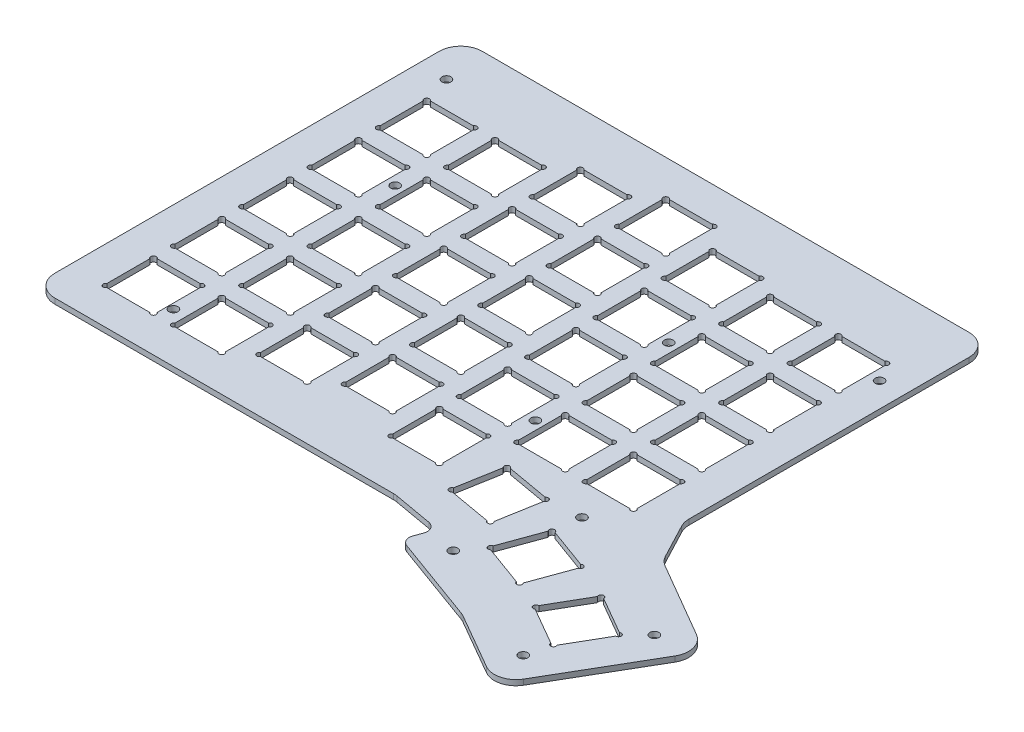
from build123d import *

# Parameters (mm, degrees)
BOSS_EXTRUDE1_DEPTH = 1.5
SKETCH2_R           = 0.75
SKETCH2_W           = 14
SKETCH2_H           = 14
CUT_EXTRUDE1_DEPTH  = 10
SKETCH3_R           = 0.75
SKETCH3_W           = 14
SKETCH3_H           = 14
CUT_EXTRUDE2_DEPTH  = 10
SKETCH4_R           = 0.75
SKETCH4_W           = 14
SKETCH4_H           = 14
CUT_EXTRUDE3_DEPTH  = 10
SKETCH5_R           = 0.75
SKETCH5_W           = 14
SKETCH5_H           = 14
CUT_EXTRUDE4_DEPTH  = 10
SKETCH6_R           = 0.75
SKETCH6_W           = 14
SKETCH6_H           = 14
CUT_EXTRUDE5_DEPTH  = 10
SKETCH7_R           = 0.75
SKETCH7_W           = 14
SKETCH7_H           = 14
CUT_EXTRUDE6_DEPTH  = 10
SKETCH8_R           = 0.75
SKETCH8_W           = 14
SKETCH8_H           = 14
CUT_EXTRUDE7_DEPTH  = 10
LPATTERN1_COUNT     = 5
LPATTERN1_PITCH     = 19.05
LPATTERN2_COUNT     = 4
LPATTERN2_PITCH     = 19.05
SKETCH10_R          = 0.75
CUT_EXTRUDE8_DEPTH  = 10
SKETCH11_R          = 0.75
CUT_EXTRUDE10_DEPTH = 10
SKETCH12_R          = 0.75
CUT_EXTRUDE11_DEPTH = 10
SKETCH50_R          = 1.25
CUT_EXTRUDE13_DEPTH = 10
FILLET1_R           = 6
FILLET2_R           = 2.5


with BuildPart() as part:
    # Sketch1 → Boss-Extrude1 (new body)
    with BuildSketch(Plane(origin=(0, 0, 0), x_dir=(1, 0, 0), z_dir=(0, 1, 0))):
        Polygon((-117.355034456, 131.523103405), (30.445045876, 131.522998334), (30.445045876, 45.958501014), (36.956704593, 33.586142525), (64.573600129, 17.512220012), (43.037533241, -19.489284069), (21.881519825, -7.274833975), (-4.824063938, 2.445225104), (-2.141519295, 9.815439635), (-16.36272095, 12.323031609), (-117.355034456, 12.323103405), align=None)
    extrude(amount=-BOSS_EXTRUDE1_DEPTH)

    # Sketch2 → Cut-Extrude1 (cut)
    with BuildSketch(Plane(origin=(0, 0, 0), x_dir=(1, 0, 0), z_dir=(0, 1, 0))):
        with Locations((-50.113481065, 121.469492511)):
            Circle(SKETCH2_R)
        with Locations((-36.820587847, 121.469492511)):
            Circle(SKETCH2_R)
        with Locations((-36.820587847, 108.176599292)):
            Circle(SKETCH2_R)
        with Locations((-50.113481065, 108.176599292)):
            Circle(SKETCH2_R)
        with Locations((-43.467034456, 114.823045901)):
            Rectangle(SKETCH2_W, SKETCH2_H)
    cut_extrude1 = extrude(amount=-CUT_EXTRUDE1_DEPTH, mode=Mode.SUBTRACT)

    # Sketch3 → Cut-Extrude2 (cut)
    with BuildSketch(Plane(origin=(0, 0, 0), x_dir=(1, 0, 0), z_dir=(0, 1, 0))):
        with Locations((-69.163481065, 116.706992511)):
            Circle(SKETCH3_R)
        with Locations((-55.870587847, 116.706992511)):
            Circle(SKETCH3_R)
        with Locations((-55.870587847, 103.414099292)):
            Circle(SKETCH3_R)
        with Locations((-69.163481065, 103.414099292)):
            Circle(SKETCH3_R)
        with Locations((-62.517034456, 110.060545901)):
            Rectangle(SKETCH3_W, SKETCH3_H)
    cut_extrude2 = extrude(amount=-CUT_EXTRUDE2_DEPTH, mode=Mode.SUBTRACT)

    # Sketch4 → Cut-Extrude3 (cut)
    with BuildSketch(Plane(origin=(0, 0, 0), x_dir=(1, 0, 0), z_dir=(0, 1, 0))):
        with Locations((-88.213481065, 111.944492511)):
            Circle(SKETCH4_R)
        with Locations((-74.920587847, 111.944492511)):
            Circle(SKETCH4_R)
        with Locations((-74.920587847, 98.651599292)):
            Circle(SKETCH4_R)
        with Locations((-88.213481065, 98.651599292)):
            Circle(SKETCH4_R)
        with Locations((-81.567034456, 105.298045901)):
            Rectangle(SKETCH4_W, SKETCH4_H)
    cut_extrude3 = extrude(amount=-CUT_EXTRUDE3_DEPTH, mode=Mode.SUBTRACT)

    # Sketch5 → Cut-Extrude4 (cut)
    with BuildSketch(Plane(origin=(0, 0, 0), x_dir=(1, 0, 0), z_dir=(0, 1, 0))):
        with Locations((-107.263481065, 111.944492511)):
            Circle(SKETCH5_R)
        with Locations((-93.970587847, 111.944492511)):
            Circle(SKETCH5_R)
        with Locations((-93.970587847, 98.651599292)):
            Circle(SKETCH5_R)
        with Locations((-107.263481065, 98.651599292)):
            Circle(SKETCH5_R)
        with Locations((-100.617034456, 105.298045901)):
            Rectangle(SKETCH5_W, SKETCH5_H)
    cut_extrude4 = extrude(amount=-CUT_EXTRUDE4_DEPTH, mode=Mode.SUBTRACT)

    # Sketch6 → Cut-Extrude5 (cut)
    with BuildSketch(Plane(origin=(0, 0, 0), x_dir=(1, 0, 0), z_dir=(0, 1, 0))):
        with Locations((-17.770587847, 115.469492511)):
            Circle(SKETCH6_R)
        with Locations((-31.063481065, 115.469492511)):
            Circle(SKETCH6_R)
        with Locations((-31.063481065, 102.176599292)):
            Circle(SKETCH6_R)
        with Locations((-17.770587847, 102.176599292)):
            Circle(SKETCH6_R)
        with Locations((-24.417034456, 108.823045901)):
            Rectangle(SKETCH6_W, SKETCH6_H)
    cut_extrude5 = extrude(amount=-CUT_EXTRUDE5_DEPTH, mode=Mode.SUBTRACT)

    # Sketch7 → Cut-Extrude6 (cut)
    with BuildSketch(Plane(origin=(0, 0, 0), x_dir=(1, 0, 0), z_dir=(0, 1, 0))):
        with Locations((-12.013481065, 112.469492511)):
            Circle(SKETCH7_R)
        with Locations((1.279412153, 112.469492511)):
            Circle(SKETCH7_R)
        with Locations((1.279412153, 99.176599292)):
            Circle(SKETCH7_R)
        with Locations((-12.013481065, 99.176599292)):
            Circle(SKETCH7_R)
        with Locations((-5.367034456, 105.823045901)):
            Rectangle(SKETCH7_W, SKETCH7_H)
    cut_extrude6 = extrude(amount=-CUT_EXTRUDE6_DEPTH, mode=Mode.SUBTRACT)

    # Sketch8 → Cut-Extrude7 (cut)
    with BuildSketch(Plane(origin=(0, 0, 0), x_dir=(1, 0, 0), z_dir=(0, 1, 0))):
        with Locations((7.036518935, 112.469492511)):
            Circle(SKETCH8_R)
        with Locations((20.329412153, 112.469492511)):
            Circle(SKETCH8_R)
        with Locations((20.329412153, 99.176599292)):
            Circle(SKETCH8_R)
        with Locations((7.036518935, 99.176599292)):
            Circle(SKETCH8_R)
        with Locations((13.682965544, 105.823045901)):
            Rectangle(SKETCH8_W, SKETCH8_H)
    cut_extrude7 = extrude(amount=-CUT_EXTRUDE7_DEPTH, mode=Mode.SUBTRACT)

    # LPattern1: Cut-Extrude1, Cut-Extrude2, Cut-Extrude3, Cut-Extrude4, Cut-Extrude5 ×5
    with Locations(*[(0, 0, i * LPATTERN1_PITCH) for i in range(1, LPATTERN1_COUNT)]):
        add(cut_extrude1, mode=Mode.SUBTRACT)
        add(cut_extrude2, mode=Mode.SUBTRACT)
        add(cut_extrude3, mode=Mode.SUBTRACT)
        add(cut_extrude4, mode=Mode.SUBTRACT)
        add(cut_extrude5, mode=Mode.SUBTRACT)

    # LPattern2: Cut-Extrude6, Cut-Extrude7 ×4
    with Locations(*[(0, 0, i * LPATTERN2_PITCH) for i in range(1, LPATTERN2_COUNT)]):
        add(cut_extrude6, mode=Mode.SUBTRACT)
        add(cut_extrude7, mode=Mode.SUBTRACT)

    # Sketch10 → Cut-Extrude8 (cut)
    with BuildSketch(Plane(origin=(0, 0, 0), x_dir=(1, 0, 0), z_dir=(0, 1, 0))):
        with Locations((-7.382259889, 34.446558018)):
            Circle(SKETCH10_R)
        with Locations((5.708684413, 32.138271335)):
            Circle(SKETCH10_R)
        with Locations((3.400397729, 19.047327033)):
            Circle(SKETCH10_R)
        with Locations((-9.690546573, 21.355613716)):
            Circle(SKETCH10_R)
        Polygon((-7.669048107, 34.85613404), (6.118260435, 32.425059553), (3.687185948, 18.637751011), (-10.100122595, 21.068825498), align=None)
    extrude(amount=-CUT_EXTRUDE8_DEPTH, mode=Mode.SUBTRACT)

    # Sketch11 → Cut-Extrude10 (cut)
    with BuildSketch(Plane(origin=(0, 0, 0), x_dir=(1, 0, 0), z_dir=(0, 1, 0))):
        with Locations((14.285945211, 25.330662706)):
            Circle(SKETCH11_R)
        with Locations((26.777178877, 20.784225462)):
            Circle(SKETCH11_R)
        with Locations((22.230741634, 8.292991795)):
            Circle(SKETCH11_R)
        with Locations((9.739507967, 12.839429039)):
            Circle(SKETCH11_R)
        Polygon((14.07463608, 25.783816599), (27.230332771, 20.995534593), (22.442050764, 7.839837902), (9.286354073, 12.628119908), align=None)
    extrude(amount=-CUT_EXTRUDE10_DEPTH, mode=Mode.SUBTRACT)

    # Sketch12 → Cut-Extrude11 (cut)
    with BuildSketch(Plane(origin=(0, 0, 0), x_dir=(1, 0, 0), z_dir=(0, 1, 0))):
        with Locations((37.028854834, 16.292284404)):
            Circle(SKETCH12_R)
        with Locations((48.540833326, 9.645829611)):
            Circle(SKETCH12_R)
        with Locations((41.894378533, -1.866148881)):
            Circle(SKETCH12_R)
        with Locations((30.38240004, 4.780305912)):
            Circle(SKETCH12_R)
        Polygon((36.899445654, 16.775247409), (49.023796331, 9.77523879), (42.023787712, -2.349111886), (29.899437035, 4.650896733), align=None)
    extrude(amount=-CUT_EXTRUDE11_DEPTH, mode=Mode.SUBTRACT)

    # Sketch50 → Cut-Extrude13 (cut)
    with BuildSketch(Plane(origin=(0, 0, 0), x_dir=(-1, 0, 0), z_dir=(0, -1, 0))):
        with Locations((109.569482084, 119.75309787)):
            Circle(SKETCH50_R)
        with Locations((-23.630509101, 107.353003178)):
            Circle(SKETCH50_R)
        with Locations((92.124496825, 26.167060303)):
            Circle(SKETCH50_R)
        with Locations((14.969505259, 87.153030619)):
            Circle(SKETCH50_R)
        with Locations((-15.130456139, 32.853009221)):
            Circle(SKETCH50_R)
        with Locations((-53.630443129, 14.552981851)):
            Circle(SKETCH50_R)
        with Locations((-40.230426636, -8.647008623)):
            Circle(SKETCH50_R)
        with Locations((-5.230437655, 6.853016259)):
            Circle(SKETCH50_R)
        with Locations((14.769531847, 49.753030477)):
            Circle(SKETCH50_R)
        with Locations((91.069505401, 86.953084718)):
            Circle(SKETCH50_R)
    extrude(amount=CUT_EXTRUDE13_DEPTH, mode=Mode.SUBTRACT)

    # Fillet1
    fillet1_edges = [part.edges().sort_by_distance(p)[0] for p in [
        (-117.355034456, -0.75, -131.523103405),
        (-117.355034456, -0.75, -12.323103405),
        (-16.36272095, -0.75, -12.323031609),
        (21.881519825, -0.75, 7.274833975),
        (43.037533241, -0.75, 19.489284069),
        (64.573600129, -0.75, -17.512220012),
        (36.956704593, -0.75, -33.586142525),
        (30.445045876, -0.75, -45.958501014),
        (30.445045876, -0.75, -131.522998334),
    ]]
    fillet(fillet1_edges, radius=FILLET1_R)

    # Fillet2
    fillet2_edges = [part.edges().sort_by_distance(p)[0] for p in [
        (-2.141519295, -0.75, -9.815439635),
        (-4.824063938, -0.75, -2.445225104),
    ]]
    fillet(fillet2_edges, radius=FILLET2_R)


solid = part.part
